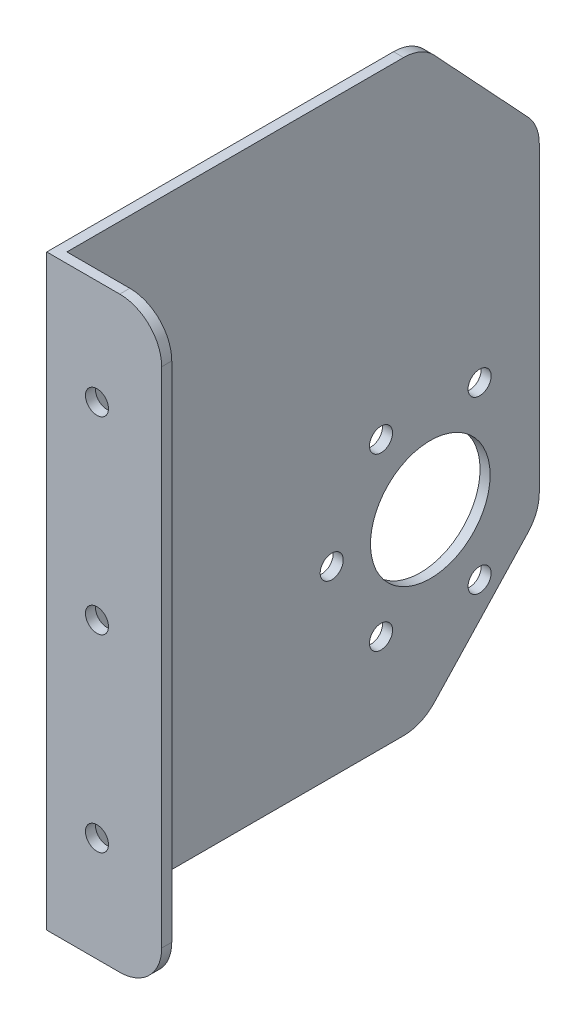
from build123d import *

# Parameters (mm, degrees)
SKETCH1_W           = 115
SKETCH1_H           = 140
BOSS_EXTRUDE1_DEPTH = 2.4
CUT_EXTRUDE1_DEPTH  = 182.192604706
FILLET1_R           = 10
SKETCH3_W           = 2.4
SKETCH3_H           = 140
BOSS_EXTRUDE2_DEPTH = 25
FILLET2_R           = 10
SKETCH4_R           = 2.75
CUT_EXTRUDE2_DEPTH  = 184.236895848
SKETCH5_R           = 14.26
SKETCH5_R_2         = 2.75
CUT_EXTRUDE3_DEPTH  = 183.893411582


with BuildPart() as part:
    # Sketch1 → Boss-Extrude1 (new body)
    with BuildSketch(Plane(origin=(0, 0, 0), x_dir=(0, 0, -1), z_dir=(1, 0, 0))):
        with Locations((57.5, -70)):
            Rectangle(SKETCH1_W, SKETCH1_H)
    extrude(amount=BOSS_EXTRUDE1_DEPTH)

    # Sketch2 → Cut-Extrude1 (cut, through all)
    with BuildSketch(Plane(origin=(2.4, 0, 0), x_dir=(0, 0, -1), z_dir=(1, 0, 0))):
        Polygon((87, 0), (115, -30), (142.616199658, -32.505405645), (142.616199658, 14.875556406), align=None)
        Polygon((115, -110), (87, -140), (87, -152.661109726), (136.310004643, -152.661109726), align=None)
    extrude(amount=-CUT_EXTRUDE1_DEPTH, mode=Mode.SUBTRACT)

    # Fillet1
    fillet1_edges = [part.edges().sort_by_distance(p)[0] for p in [
        (1.2, -140, -87),
        (1.2, -110, -115),
        (1.2, -30, -115),
        (1.2, 0, -87),
    ]]
    fillet(fillet1_edges, radius=FILLET1_R)

    # Sketch3 → Boss-Extrude2 (add)
    with BuildSketch(Plane(origin=(2.4, 0, 0), x_dir=(0, 0, -1), z_dir=(1, 0, 0))):
        with Locations((1.2, -70)):
            Rectangle(SKETCH3_W, SKETCH3_H)
    extrude(amount=BOSS_EXTRUDE2_DEPTH)

    # Fillet2
    fillet2_edges = [part.edges().sort_by_distance(p)[0] for p in [
        (27.4, -140, -1.2),
        (27.4, 0, -1.2),
    ]]
    fillet(fillet2_edges, radius=FILLET2_R)

    # Sketch4 → Cut-Extrude2 (cut, through all)
    with BuildSketch(Plane.XY):
        with Locations((11.974983581, -70)):
            Circle(SKETCH4_R)
        with Locations((11.974983581, -25)):
            Circle(SKETCH4_R)
        with Locations((11.974983581, -115)):
            Circle(SKETCH4_R)
    extrude(amount=-CUT_EXTRUDE2_DEPTH, mode=Mode.SUBTRACT)

    # Sketch5 → Cut-Extrude3 (cut, through all)
    with BuildSketch(Plane(origin=(2.4, 0, 0), x_dir=(0, 0, -1), z_dir=(1, 0, 0))):
        with Locations((89.027947804, -96.494029199)):
            Circle(SKETCH5_R)
        with Locations((77.277947804, -76.14243221)):
            Circle(SKETCH5_R_2)
        with Locations((100.777947804, -76.14243221)):
            Circle(SKETCH5_R_2)
        with Locations((100.777947804, -116.845626188)):
            Circle(SKETCH5_R_2)
        with Locations((77.277947804, -116.845626188)):
            Circle(SKETCH5_R_2)
        with Locations((65.527947804, -96.494029199)):
            Circle(SKETCH5_R_2)
    extrude(amount=-CUT_EXTRUDE3_DEPTH, mode=Mode.SUBTRACT)


solid = part.part
